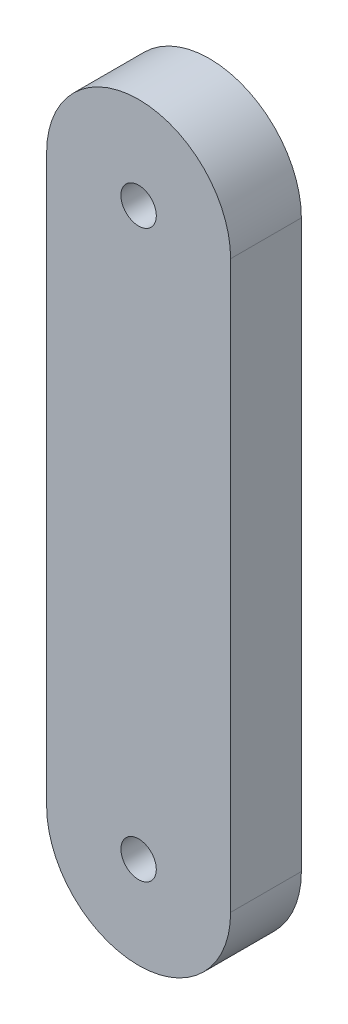
from build123d import *

# Parameters (mm, degrees)
SKETCH1_R           = 0.625
BOSS_EXTRUDE1_DEPTH = 2.5


with BuildPart() as part:
    # Sketch1 → Boss-Extrude1 (new body)
    with BuildSketch(Plane.XY):
        with BuildLine():
            Line((-3.25, 0), (-3.25, 20))
            ThreePointArc((-3.25, 20), (0, 23.25), (3.25, 20))
            Line((3.25, 20), (3.25, 0))
            ThreePointArc((3.25, 0), (0, -3.25), (-3.25, 0))
        make_face()
        with Locations((0, 20)):
            Circle(SKETCH1_R, mode=Mode.SUBTRACT)
        Circle(SKETCH1_R, mode=Mode.SUBTRACT)
    extrude(amount=BOSS_EXTRUDE1_DEPTH)


solid = part.part
